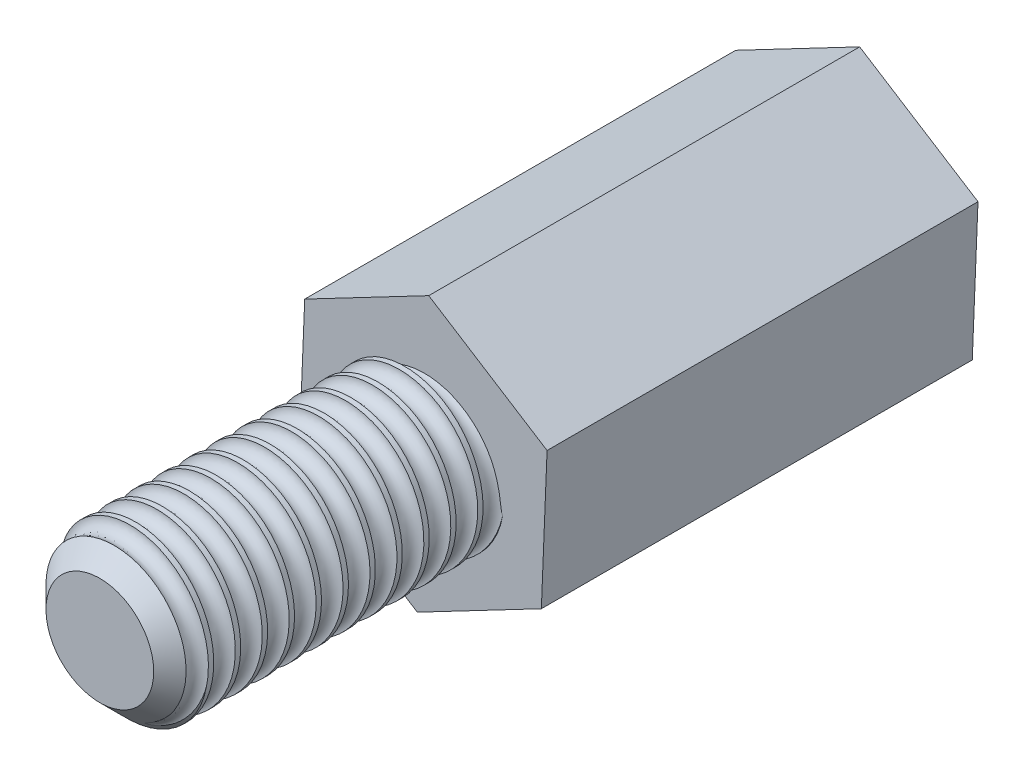
from build123d import *

# Parameters (mm, degrees)
EXTRUDE_1_DEPTH        = 8
SKETCH_2_R             = 1.5
EXTRUDE_2_DEPTH        = 6
CHAMFER_1_SIZE         = 0.5
SWEEP_1_PITCH          = 0.5
SWEEP_1_FROM           = 0
HOLE_WIZARD_M3_1_D     = 2.5
HOLE_WIZARD_M3_1_DEPTH = 5
HOLE_WIZARD_M3_1_TIP   = 0.751075774


with BuildPart() as part:
    # 草图1 → 凸台-拉伸1 (new body)
    with BuildSketch(Plane.XY):
        Polygon((2.302890401, 1.206936535), (0.1062075, 2.597829857), (-2.196682901, 1.390893322), (-2.302890401, -1.206936535), (-0.1062075, -2.597829857), (2.196682901, -1.390893322), align=None)
    extrude(amount=EXTRUDE_1_DEPTH)

    # 草图2 → 凸台-拉伸2 (add)
    with BuildSketch(Plane.XY.offset(8)):
        Circle(SKETCH_2_R)
    extrude(amount=EXTRUDE_2_DEPTH)

    # 倒角1
    chamfer_1_edges = [part.edges().sort_by_distance(p)[0] for p in [
        (-1.5, 0, 14),
    ]]
    chamfer(chamfer_1_edges, length=CHAMFER_1_SIZE)

    # 切除-扫描1: arcs per turn and ends read off the stored shape
    # 切除-扫描1: the profile of 草图4 screwed along a left-hand helix through 12.666667 turns, 6 arcs to a turn; built about Z, then put on its axis
    sweep_1_z = Axis((0, 0, 0), (0, 0, 1))
    sweep_1_corners = [(1.5, -0.01059543, -0.699719145), (1.7, 0, -0.5), (1.5, 0.01059543, -0.300280855), (1.3, 0, -0.5)]
    with BuildLine(mode=Mode.PRIVATE) as sweep_1_profile:
        ThreePointArc((1.5, -0.01059543, -0.699719145), (1.641421356, -0.0074921, -0.641222762), (1.7, 0, -0.5))
        ThreePointArc((1.7, 0, -0.5), (1.641421356, 0.0074921, -0.358777238), (1.5, 0.01059543, -0.300280855))
        ThreePointArc((1.5, 0.01059543, -0.300280855), (1.358578644, 0.0074921, -0.358777238), (1.3, 0, -0.5))
        ThreePointArc((1.3, 0, -0.5), (1.358578644, -0.0074921, -0.641222762), (1.5, -0.01059543, -0.699719145))
    sweep_1_cap = Face(sweep_1_profile.wire())
    sweep_1_arcs = [((1.5, -0.01059543, -0.699719145), (1.7, -0.01059543, -0.699719145), (1.7, 0, -0.5), (1, 0.7071067811865475, 1)), ((1.7, 0, -0.5), (1.7, 0.01059543, -0.300280855), (1.5, 0.01059543, -0.300280855), (1, 0.7071067811865475, 1)), ((1.5, 0.01059543, -0.300280855), (1.3, 0.01059543, -0.300280855), (1.3, 0, -0.5), (1, 0.7071067811865475, 1)), ((1.3, 0, -0.5), (1.3, -0.01059543, -0.699719145), (1.5, -0.01059543, -0.699719145), (1, 0.7071067811865475, 1))]  # start, shoulder, end, weights
    sweep_1_turn_angles = [0, -30, -60, -90, -120, -150, -180, -210, -240, -270, -300, -330, -360]
    sweep_1_turn_weights = [1, 0.8660254037844387, 1, 0.8660254037844387, 1, 0.8660254037844387, 1, 0.8660254037844387, 1, 0.8660254037844387, 1, 0.8660254037844387, 1]
    sweep_1_turn_sides = [Face.make_bezier_surface([[Vector(p[j][0], p[j][1], 0).rotate(sweep_1_z, sweep_1_turn_angles[2 * i + k]) / sweep_1_turn_weights[2 * i + k] + Vector(0, 0, p[j][2] + -SWEEP_1_PITCH * sweep_1_turn_angles[2 * i + k] / 360) for k in range(3)] for j in range(3)], [[p[3][j] * sweep_1_turn_weights[2 * i + k] for k in range(3)] for j in range(3)]) for p in sweep_1_arcs for i in range(6)]
    sweep_1_last_angles = [-4320, -4350, -4380, -4410, -4440, -4470, -4500, -4530, -4560]
    sweep_1_last_weights = [1, 0.8660254037844387, 1, 0.8660254037844387, 1, 0.8660254037844387, 1, 0.8660254037844387, 1]
    sweep_1_last_sides = [Face.make_bezier_surface([[Vector(p[j][0], p[j][1], 0).rotate(sweep_1_z, sweep_1_last_angles[2 * i + k]) / sweep_1_last_weights[2 * i + k] + Vector(0, 0, p[j][2] + -SWEEP_1_PITCH * sweep_1_last_angles[2 * i + k] / 360) for k in range(3)] for j in range(3)], [[p[3][j] * sweep_1_last_weights[2 * i + k] for k in range(3)] for j in range(3)]) for p in sweep_1_arcs for i in range(4)]
    sweep_1 = Plane(origin=(0, 0, 8), x_dir=(-0.7071067811865512, 0.7071067811865438, 0), z_dir=(0, 0, 1)) * split(Solid(Shell([*[p.moved(Location((0, 0, SWEEP_1_PITCH * i))) for i in range(12) for p in sweep_1_turn_sides], *sweep_1_last_sides, sweep_1_cap, sweep_1_cap.rotate(sweep_1_z, -4560).moved(Location((0, 0, -SWEEP_1_PITCH * -4560 / 360)))])), bisect_by=Plane.XY.offset(SWEEP_1_FROM), keep=Keep.TOP, mode=Mode.PRIVATE)
    add(sweep_1, mode=Mode.SUBTRACT)

    # M3 螺纹孔1
    with Locations(Plane(origin=(0, 0, 0), x_dir=(-1, 0, 0), z_dir=(0, 0, -1))):
        with Locations((0, 0)):
            Hole(HOLE_WIZARD_M3_1_D / 2, depth=HOLE_WIZARD_M3_1_DEPTH)
            with Locations((0, 0, -(HOLE_WIZARD_M3_1_DEPTH + HOLE_WIZARD_M3_1_TIP / 2))):  # 118° drill point
                Cone(0, HOLE_WIZARD_M3_1_D / 2, HOLE_WIZARD_M3_1_TIP, mode=Mode.SUBTRACT)


solid = part.part
